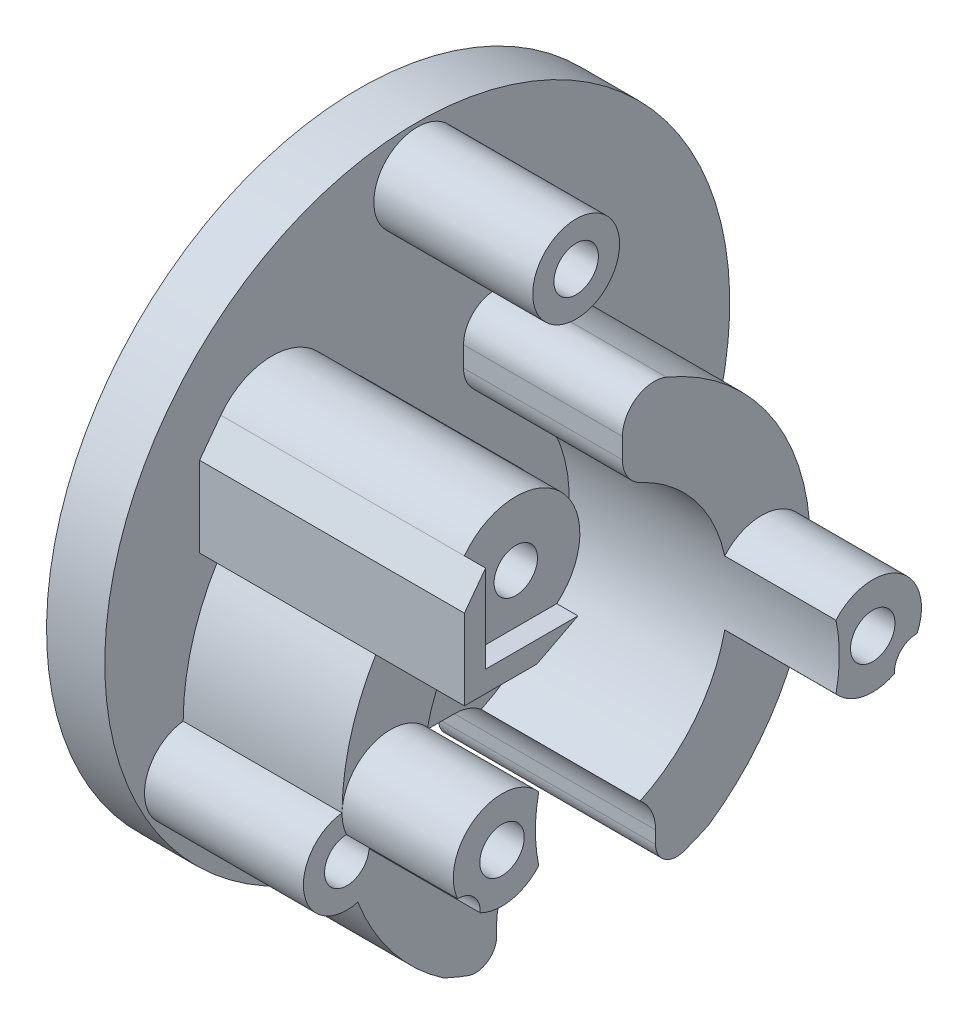
from build123d import *

# Parameters (mm, degrees)
SKETCH1_R            = 29.5
BOSS_EXTRUDE1_DEPTH  = 3
SKETCH1_3_R          = 2.1
BOSS_EXTRUDE2_DEPTH  = 28.5
SKETCH1_4_R          = 2.1
BOSS_EXTRUDE3_DEPTH  = 18
BOSS_EXTRUDE4_DEPTH  = 18
SKETCH3_R            = 4.1
SKETCH3_R_2          = 2.1
BOSS_EXTRUDE5_DEPTH  = 18
SKETCH3_2_R          = 2.1
CUT_EXTRUDE1_DEPTH   = 51.524746412
CUT_EXTRUDE4_DEPTH   = 46.436769251
FILLET1_R            = 4
FILLET2_R            = 2
BOSS_EXTRUDE6_START  = 2.5
SKETCH5_R            = 2.1
BOSS_EXTRUDE6_DEPTH  = 2.5
BOSS_EXTRUDE8_DEPTH  = 23
BOSS_EXTRUDE10_DEPTH = 25
CUT_EXTRUDE5_START   = -23
SKETCH8_R            = 2.05
CUT_EXTRUDE5_DEPTH   = 23
SKETCH9_W            = 8.73918865
SKETCH9_H            = 13.66749207
CUT_EXTRUDE6_DEPTH   = 15
FILLET6_R            = 3


with BuildPart() as part:
    # Sketch1 → Boss-Extrude1 (new body)
    with BuildSketch(Plane(origin=(0, 0, 0), x_dir=(0, 0, -1), z_dir=(1, 0, 0))):
        Circle(SKETCH1_R)
    extrude(amount=BOSS_EXTRUDE1_DEPTH)

    # Sketch1<3> → Boss-Extrude2 (add)
    # profile 1 of 2: a face of its own
    with BuildSketch(Plane(origin=(0, 0, 0), x_dir=(0, 0, -1), z_dir=(1, 0, 0))):
        with BuildLine():
            ThreePointArc((-14.028928571, -5.481446847), (-22.1, -8.5), (-14.028928571, -11.518553153))
            ThreePointArc((-14.028928571, -11.518553153), (-14.35, -8.5), (-14.028928571, -5.481446847))
        make_face()
        with Locations(Location((-17.5, -8.5, 0), (0, 0, 180))):
            Circle(SKETCH1_3_R, mode=Mode.SUBTRACT)
    # profile 2 of 2: a face of its own
    with BuildSketch(Plane(origin=(0, 0, 0), x_dir=(0, 0, -1), z_dir=(1, 0, 0))):
        with BuildLine():
            ThreePointArc((14.028928571, -11.518553153), (22.1, -8.5), (14.028928571, -5.481446847))
            ThreePointArc((14.028928571, -5.481446847), (14.35, -8.5), (14.028928571, -11.518553153))
        make_face()
        with Locations(Location((17.5, -8.5, 0), (0, 0, 180))):
            Circle(SKETCH1_3_R, mode=Mode.SUBTRACT)
    extrude(amount=BOSS_EXTRUDE2_DEPTH)

    # Sketch1<4> → Boss-Extrude3 (add)
    with BuildSketch(Plane(origin=(0, 0, 0), x_dir=(0, 0, -1), z_dir=(1, 0, 0))):
        with BuildLine():
            ThreePointArc((-22.1, -8.5), (-19.559053733, -18.788508981), (-12.520505244, -26.711176471))
            ThreePointArc((-12.520505244, -26.711176471), (0, -29.5), (12.520505244, -26.711176471))
            ThreePointArc((12.520505244, -26.711176471), (19.559053733, -18.788508981), (22.1, -8.5))
            ThreePointArc((22.1, -8.5), (19.111376962, -12.808533891), (14.028928571, -11.518553153))
            ThreePointArc((14.028928571, -11.518553153), (0, -22.85), (-14.028928571, -11.518553153))
            ThreePointArc((-14.028928571, -11.518553153), (-19.111376962, -12.808533891), (-22.1, -8.5))
        make_face()
        with Locations((-17.5, -8.5)):
            Circle(SKETCH1_4_R)
        with Locations((17.5, -8.5)):
            Circle(SKETCH1_4_R)
    extrude(amount=BOSS_EXTRUDE3_DEPTH)

    # Sketch1<5> → Boss-Extrude4 (add)
    with BuildSketch(Plane(origin=(0, 0, 0), x_dir=(0, 0, -1), z_dir=(1, 0, 0))):
        with BuildLine():
            ThreePointArc((22.1, -8.5), (0, 13.6), (-22.1, -8.5))
            ThreePointArc((-22.1, -8.5), (-19.111376962, -4.191466109), (-14.028928571, -5.481446847))
            ThreePointArc((-14.028928571, -5.481446847), (0, 5.85), (14.028928571, -5.481446847))
            ThreePointArc((14.028928571, -5.481446847), (19.111376962, -4.191466109), (22.1, -8.5))
        make_face()
    extrude(amount=BOSS_EXTRUDE4_DEPTH)

    # Sketch3 → Boss-Extrude5 (add)
    # profile 1 of 3: a face of its own
    with BuildSketch(Plane.ZY):
        with Locations(Location((0, 25, 0), (0, 0, 180))):
            Circle(SKETCH3_R)
        with Locations(Location((0, 25, 0), (0, 0, 180))):
            Circle(SKETCH3_R_2, mode=Mode.SUBTRACT)
    # profile 2 of 3: a face of its own
    with BuildSketch(Plane.ZY):
        with Locations((21.650635095, -12.5)):
            Circle(SKETCH3_R)
        with Locations((21.650635095, -12.5)):
            Circle(SKETCH3_R_2, mode=Mode.SUBTRACT)
    # profile 3 of 3: a face of its own
    with BuildSketch(Plane.ZY):
        with Locations((-21.650635095, -12.5)):
            Circle(SKETCH3_R)
        with Locations((-21.650635095, -12.5)):
            Circle(SKETCH3_R_2, mode=Mode.SUBTRACT)
    extrude(amount=-BOSS_EXTRUDE5_DEPTH)

    # Sketch3<2> → Cut-Extrude1 (cut, through all)
    with BuildSketch(Plane.ZY):
        with Locations((-21.650635095, -12.5)):
            Circle(SKETCH3_2_R)
        with BuildLine():
            ThreePointArc((0, 27.1), (-2.1, 25), (0, 22.9))
            Line((0, 22.9), (0, 27.1))
        make_face()
        with BuildLine():
            Line((0, 27.1), (0, 22.9))
            ThreePointArc((0, 22.9), (1.48492424, 23.51507576), (2.1, 25))
            ThreePointArc((2.1, 25), (1.48492424, 26.48492424), (0, 27.1))
        make_face()
        with Locations((21.650635095, -12.5)):
            Circle(SKETCH3_2_R)
    extrude(amount=-CUT_EXTRUDE1_DEPTH, mode=Mode.SUBTRACT)

    # Sketch4 → Cut-Extrude4 (cut, through all)
    with BuildSketch(Plane(origin=(18, 0, 0), x_dir=(0, 0, -1), z_dir=(1, 0, 0))):
        Polygon((-7.5, -22.75), (-7.5, -29.5), (-7.5, -30.430558557), (7.5, -30.430558557), (7.5, -29.5), (7.5, -22.75), (7.5, -20.616620816), (-7.5, -20.616620816), align=None)
    extrude(amount=-CUT_EXTRUDE4_DEPTH, mode=Mode.SUBTRACT)

    # Fillet1
    # the kernel refuses this fillet: 4 mm, written as the material it adds along each edge
    with BuildSketch(Plane(origin=(27, -20.616620816, -7.5), x_dir=(0, 0, 1), z_dir=(-1, 0, 0))) as fillet1_piece_1_section:
        with BuildLine():
            CenterArc((FILLET1_R, -FILLET1_R), FILLET1_R, 90, 90)
            Line((0, -FILLET1_R), (-FILLET1_R * 0.02, -FILLET1_R))
            Line((-FILLET1_R * 0.02, -FILLET1_R), (-FILLET1_R * 0.02, FILLET1_R * 0.02))
            Line((-FILLET1_R * 0.02, FILLET1_R * 0.02), (FILLET1_R, FILLET1_R * 0.02))
            Line((FILLET1_R, FILLET1_R * 0.02), (FILLET1_R, 0))
        make_face()
    fillet1_piece_1 = extrude(amount=27, mode=Mode.PRIVATE)
    fillet1_piece_1 = split(fillet1_piece_1, bisect_by=Plane(origin=(3, -22.074099396, -7.128838898), z_dir=(1, 0, 0)), keep=Keep.TOP, mode=Mode.PRIVATE)
    fillet1_piece_1 = fillet1_piece_1 - Plane(origin=(10.5, -8.5, 0), x_dir=(0, 0.21035213610066375, -0.9776256844201097), z_dir=(-1, 0, 0)) * Cylinder(14.35, 70, mode=Mode.PRIVATE)
    fillet1_piece_1 = split(fillet1_piece_1, bisect_by=Plane(origin=(18, -22.074099396, -7.128838898), z_dir=(-1, 0, 0)), keep=Keep.TOP, mode=Mode.PRIVATE)
    add(fillet1_piece_1)
    with BuildSketch(Plane(origin=(3, -20.616620816, -7.5), x_dir=(0, 0, 1), z_dir=(-1, 0, 0))) as fillet1_piece_2_section:
        with BuildLine():
            CenterArc((FILLET1_R, -FILLET1_R), FILLET1_R, 90, 90)
            Line((0, -FILLET1_R), (-FILLET1_R * 0.02, -FILLET1_R))
            Line((-FILLET1_R * 0.02, -FILLET1_R), (-FILLET1_R * 0.02, FILLET1_R * 0.02))
            Line((-FILLET1_R * 0.02, FILLET1_R * 0.02), (FILLET1_R, FILLET1_R * 0.02))
            Line((FILLET1_R, FILLET1_R * 0.02), (FILLET1_R, 0))
        make_face()
    fillet1_piece_2 = extrude(amount=3, mode=Mode.PRIVATE)
    fillet1_piece_2 = fillet1_piece_2 & Plane(origin=(1.5, -8.5, 0), x_dir=(0, 0.21035213610066375, -0.9776256844201097), z_dir=(-1, 0, 0)) * Cylinder(14.35, 22, mode=Mode.PRIVATE)
    add(fillet1_piece_2)
    with BuildSketch(Plane(origin=(3, -20.616620816, -7.5), x_dir=(0, 0, 1), z_dir=(-1, 0, 0))) as fillet1_piece_3_section:
        with BuildLine():
            CenterArc((FILLET1_R, -FILLET1_R), FILLET1_R, 90, 90)
            Line((0, -FILLET1_R), (-FILLET1_R * 0.02, -FILLET1_R))
            Line((-FILLET1_R * 0.02, -FILLET1_R), (-FILLET1_R * 0.02, FILLET1_R * 0.02))
            Line((-FILLET1_R * 0.02, FILLET1_R * 0.02), (FILLET1_R, FILLET1_R * 0.02))
            Line((FILLET1_R, FILLET1_R * 0.02), (FILLET1_R, 0))
        make_face()
    fillet1_piece_3 = extrude(amount=3, mode=Mode.PRIVATE)
    fillet1_piece_3 = fillet1_piece_3 - Plane(origin=(1.5, -8.5, 0), x_dir=(0, 0.21035213610066375, -0.9776256844201097), z_dir=(-1, 0, 0)) * Cylinder(14.35, 22, mode=Mode.PRIVATE)
    add(fillet1_piece_3)
    with BuildSketch(Plane(origin=(27, -20.616620816, 7.5), x_dir=(0, -1, 0), z_dir=(-1, 0, 0))) as fillet1_piece_4_section:
        with BuildLine():
            CenterArc((FILLET1_R, -FILLET1_R), FILLET1_R, 90, 90)
            Line((0, -FILLET1_R), (-FILLET1_R * 0.02, -FILLET1_R))
            Line((-FILLET1_R * 0.02, -FILLET1_R), (-FILLET1_R * 0.02, FILLET1_R * 0.02))
            Line((-FILLET1_R * 0.02, FILLET1_R * 0.02), (FILLET1_R, FILLET1_R * 0.02))
            Line((FILLET1_R, FILLET1_R * 0.02), (FILLET1_R, 0))
        make_face()
    fillet1_piece_4 = extrude(amount=27, mode=Mode.PRIVATE)
    fillet1_piece_4 = split(fillet1_piece_4, bisect_by=Plane(origin=(3, -22.074099396, 7.128838898), z_dir=(1, 0, 0)), keep=Keep.TOP, mode=Mode.PRIVATE)
    fillet1_piece_4 = fillet1_piece_4 - Plane(origin=(10.5, -8.5, 0), x_dir=(0, 0.21035213610066375, -0.9776256844201097), z_dir=(-1, 0, 0)) * Cylinder(14.35, 70, mode=Mode.PRIVATE)
    fillet1_piece_4 = split(fillet1_piece_4, bisect_by=Plane(origin=(18, -22.074099396, 7.128838898), z_dir=(-1, 0, 0)), keep=Keep.TOP, mode=Mode.PRIVATE)
    add(fillet1_piece_4)
    with BuildSketch(Plane(origin=(3, -20.616620816, 7.5), x_dir=(0, -1, 0), z_dir=(-1, 0, 0))) as fillet1_piece_5_section:
        with BuildLine():
            CenterArc((FILLET1_R, -FILLET1_R), FILLET1_R, 90, 90)
            Line((0, -FILLET1_R), (-FILLET1_R * 0.02, -FILLET1_R))
            Line((-FILLET1_R * 0.02, -FILLET1_R), (-FILLET1_R * 0.02, FILLET1_R * 0.02))
            Line((-FILLET1_R * 0.02, FILLET1_R * 0.02), (FILLET1_R, FILLET1_R * 0.02))
            Line((FILLET1_R, FILLET1_R * 0.02), (FILLET1_R, 0))
        make_face()
    fillet1_piece_5 = extrude(amount=3, mode=Mode.PRIVATE)
    fillet1_piece_5 = fillet1_piece_5 - Plane(origin=(1.5, -8.5, 0), x_dir=(0, 0.21035213610066375, -0.9776256844201097), z_dir=(-1, 0, 0)) * Cylinder(14.35, 22, mode=Mode.PRIVATE)
    add(fillet1_piece_5)
    with BuildSketch(Plane(origin=(3, -20.616620816, 7.5), x_dir=(0, -1, 0), z_dir=(-1, 0, 0))) as fillet1_piece_6_section:
        with BuildLine():
            CenterArc((FILLET1_R, -FILLET1_R), FILLET1_R, 90, 90)
            Line((0, -FILLET1_R), (-FILLET1_R * 0.02, -FILLET1_R))
            Line((-FILLET1_R * 0.02, -FILLET1_R), (-FILLET1_R * 0.02, FILLET1_R * 0.02))
            Line((-FILLET1_R * 0.02, FILLET1_R * 0.02), (FILLET1_R, FILLET1_R * 0.02))
            Line((FILLET1_R, FILLET1_R * 0.02), (FILLET1_R, 0))
        make_face()
    fillet1_piece_6 = extrude(amount=3, mode=Mode.PRIVATE)
    fillet1_piece_6 = fillet1_piece_6 & Plane(origin=(1.5, -8.5, 0), x_dir=(0, 0.21035213610066375, -0.9776256844201097), z_dir=(-1, 0, 0)) * Cylinder(14.35, 22, mode=Mode.PRIVATE)
    add(fillet1_piece_6)

    # Fillet2
    fillet2_edges = [part.edges().sort_by_distance(p)[0] for p in [
        (10.5, -28.530685235, -7.5),
        (10.5, -28.530685235, 7.5),
    ]]
    fillet(fillet2_edges, radius=FILLET2_R)

    # Sketch5 → Boss-Extrude6 (add)
    with BuildSketch(Plane.ZY.offset(BOSS_EXTRUDE6_START)):
        with BuildLine():
            Line((7.5, -24.616620816), (7.5, -25.806975801))
            ThreePointArc((7.5, -25.806975801), (8.355844893, -27.447374866), (10.190909091, -27.683846768))
            ThreePointArc((10.190909091, -27.683846768), (0, 29.5), (-10.190909091, -27.683846768))
            ThreePointArc((-10.190909091, -27.683846768), (-8.355844893, -27.447374866), (-7.5, -25.806975801))
            Line((-7.5, -25.806975801), (-7.5, -24.616620816))
            ThreePointArc((-7.5, -24.616620816), (-6.328427125, -21.788193691), (-3.5, -20.616620816))
            Line((-3.5, -20.616620816), (3.5, -20.616620816))
            ThreePointArc((3.5, -20.616620816), (6.328427125, -21.788193691), (7.5, -24.616620816))
        make_face()
        with Locations((21.650635095, -12.5)):
            Circle(SKETCH5_R, mode=Mode.SUBTRACT)
        with Locations((0, 25)):
            Circle(SKETCH5_R, mode=Mode.SUBTRACT)
        with Locations((-21.650635095, -12.5)):
            Circle(SKETCH5_R, mode=Mode.SUBTRACT)
    extrude(amount=-BOSS_EXTRUDE6_DEPTH)

    # Sketch7 → Boss-Extrude8 (add)
    with BuildSketch(Plane(origin=(3, 0, 0), x_dir=(0, 0, -1), z_dir=(1, 0, 0))):
        with BuildLine():
            Line((-18.55, 14.816628264), (-18.55, 11.2))
            Line((-18.55, 11.2), (-18.55, 6.55))
            Line((-18.55, 6.55), (-16.183556469, 6.55))
            ThreePointArc((-16.183556469, 6.55), (-14.76450438, 7.944434025), (-13.225798316, 9.205599648))
            ThreePointArc((-13.225798316, 9.205599648), (-15.308510717, 12.470902543), (-11.65, 11.2))
            ThreePointArc((-11.65, 11.2), (-11.738234617, 10.60504069), (-11.995343005, 10.061296996))
            ThreePointArc((-11.995343005, 10.061296996), (-10.894985533, 10.727825936), (-9.757708838, 11.329198628))
            ThreePointArc((-9.757708838, 11.329198628), (-8.756584544, 11.791185947), (-7.73366458, 12.202667272))
            ThreePointArc((-7.73366458, 12.202667272), (-12.27882119, 17.080710058), (-18.55, 14.816628264))
        make_face()
        with BuildLine():
            ThreePointArc((-13.225798316, 9.205599648), (-14.76450438, 7.944434025), (-16.183556469, 6.55))
            Line((-16.183556469, 6.55), (-13.7, 6.55))
            Line((-13.7, 6.55), (-9.829599504, 6.55))
            ThreePointArc((-9.829599504, 6.55), (-8.027389914, 9.096670542), (-7.73366458, 12.202667272))
            ThreePointArc((-7.73366458, 12.202667272), (-8.756584544, 11.791185947), (-9.757708838, 11.329198628))
            ThreePointArc((-9.757708838, 11.329198628), (-10.894985533, 10.727825936), (-11.995343005, 10.061296996))
            ThreePointArc((-11.995343005, 10.061296996), (-12.529568125, 9.516970224), (-13.225798316, 9.205599648))
        make_face()
    extrude(amount=BOSS_EXTRUDE8_DEPTH)

    # Sketch7<4> → Boss-Extrude10 (add)
    with BuildSketch(Plane(origin=(3, 0, 0), x_dir=(0, 0, -1), z_dir=(1, 0, 0))):
        with BuildLine():
            Line((-18.55, 6.55), (-18.55, 11.2))
            Line((-18.55, 11.2), (-18.55, 14.816628264))
            Line((-18.55, 14.816628264), (-20.55, 12.134572135))
            Line((-20.55, 12.134572135), (-20.55, 11.2))
            Line((-20.55, 11.2), (-20.55, 4.55))
            Line((-20.55, 4.55), (-17.835568396, 4.55))
            ThreePointArc((-17.835568396, 4.55), (-17.038932307, 5.574259691), (-16.183556469, 6.55))
            Line((-16.183556469, 6.55), (-18.55, 6.55))
        make_face()
        with BuildLine():
            Line((-13.7, 6.55), (-16.183556469, 6.55))
            ThreePointArc((-16.183556469, 6.55), (-17.038932307, 5.574259691), (-17.835568396, 4.55))
            Line((-17.835568396, 4.55), (-13.7, 4.55))
            Line((-13.7, 4.55), (-9.829599504, 6.55))
            Line((-9.829599504, 6.55), (-13.7, 6.55))
        make_face()
    extrude(amount=BOSS_EXTRUDE10_DEPTH)

    # Sketch8 → Cut-Extrude5 (cut)
    with BuildSketch(Plane(origin=(26, 0, 0), x_dir=(0, 0, -1), z_dir=(1, 0, 0)).offset(CUT_EXTRUDE5_START)):
        with Locations((-13.7, 11.2)):
            Circle(SKETCH8_R)
    extrude(amount=CUT_EXTRUDE5_DEPTH, mode=Mode.SUBTRACT)

    # Sketch9 → Cut-Extrude6 (cut)
    with BuildSketch(Plane(origin=(18, 0, 0), x_dir=(0, 0, -1), z_dir=(1, 0, 0))):
        with Locations((0, 9.725)):
            Rectangle(SKETCH9_W, SKETCH9_H)
    extrude(amount=-CUT_EXTRUDE6_DEPTH, mode=Mode.SUBTRACT)

    # Fillet6
    # the kernel refuses this fillet: 3 mm, written as the material it takes off along each edge
    with BuildSketch(Plane(origin=(23.096273111, 5.168545842, 4.369594325), x_dir=(0, -0.36539404448262197, 0.9308529380394261), z_dir=(-1, 0, 0))) as fillet6_piece_1:
        with BuildLine():
            CenterArc((2.047699677, 2.993734453), FILLET6_R, 201.431834882, 64.86449649)
            Line((-0.744859137, 1.897552319), (-0.800710314, 1.875628677))
            Line((-0.800710314, 1.875628677), (-0.055851176, -0.021923643))
            Line((-0.055851176, -0.021923643), (0.003875772, -0.059874689))
            ThreePointArc((0.003875772, -0.059874689), (0.926955532, -0.030029799), (1.850035291, -0.059874689))
            Line((1.850035291, -0.059874689), (1.853911064, 0))
        make_face()
    extrude(amount=20.096273111, mode=Mode.SUBTRACT)
    with BuildSketch(Plane(origin=(23.096273111, 5.168545842, -4.369594325), x_dir=(0, -0.3653940444826167, -0.9308529380394283), z_dir=(-1, 0, 0))) as fillet6_piece_2:
        with BuildLine():
            CenterArc((2.047699677, -2.993734453), FILLET6_R, 93.703668629, 64.86449649)
            Line((-0.744859137, -1.897552319), (-0.800710314, -1.875628677))
            Line((-0.800710314, -1.875628677), (-0.055851176, 0.021923643))
            Line((-0.055851176, 0.021923643), (0.003875772, 0.059874689))
            ThreePointArc((0.003875772, 0.059874689), (0.926955532, 0.030029799), (1.850035291, 0.059874689))
            Line((1.850035291, 0.059874689), (1.853911064, 0))
        make_face()
    extrude(amount=20.096273111, mode=Mode.SUBTRACT)
    with BuildSketch(Plane(origin=(28.87162696, 13.163717258, -4.369594325), x_dir=(0, -0.2932034375613946, -0.9560500741081408), z_dir=(-1, 0, 0))) as fillet6_piece_3:
        with BuildLine():
            CenterArc((4.053493491, 2.985445054), FILLET6_R, 162.950161155, 112.696062027)
            Line((1.185343269, 3.865055367), (1.127980264, 3.882647573))
            Line((1.127980264, 3.882647573), (-0.057363004, 0.017592206))
            Line((-0.057363004, 0.017592206), (-0.005903146, -0.059708901))
            ThreePointArc((-0.005903146, -0.059708901), (2.174325392, -0.167221433), (4.35455393, -0.059708901))
            Line((4.35455393, -0.059708901), (4.348650784, 0))
        make_face()
    extrude(amount=25.87162696, mode=Mode.SUBTRACT)
    with BuildSketch(Plane(origin=(27.847192133, 13.163717258, 4.369594325), x_dir=(0, -0.27469128210883176, 0.9615324745079628), z_dir=(-1, 0, 0))) as fillet6_piece_4:
        with BuildLine():
            CenterArc((3.966572556, -2.963284161), FILLET6_R, 98.973206407, 96.970411036)
            Line((1.081975133, -3.787358007), (1.024283184, -3.803839484))
            Line((1.024283184, -3.803839484), (-0.057691948, -0.016481477))
            Line((-0.057691948, -0.016481477), (-0.004749305, 0.059811739))
            ThreePointArc((-0.004749305, 0.059811739), (1.749327425, 0.12934287), (3.489296496, 0.059265683))
            Line((3.489296496, 0.059265683), (3.49865485, 0))
        make_face()
    extrude(amount=24.847192133, mode=Mode.SUBTRACT)


solid = part.part
